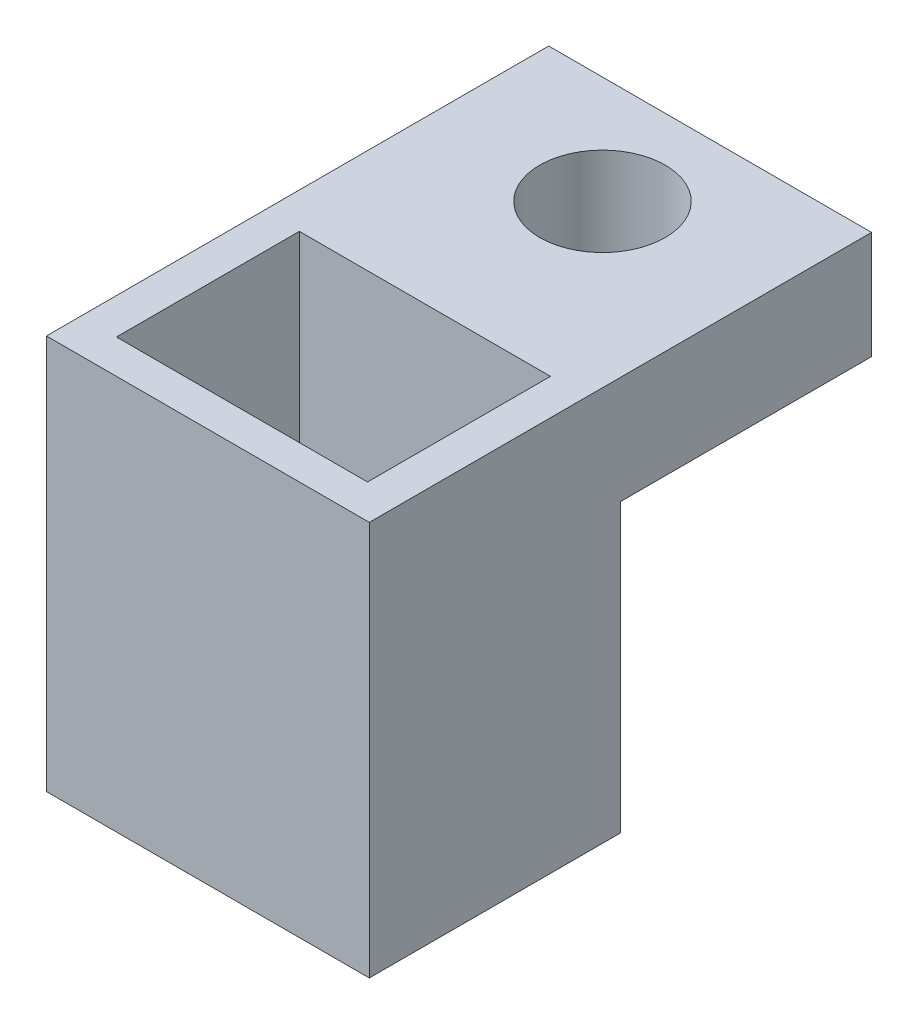
from build123d import *

# Parameters (mm, degrees)
BOSS_EXTRUDE2_DEPTH = 9
SKETCH6_R           = 1.75
SKETCH6_W           = 7
SKETCH6_H           = 5.1
CUT_EXTRUDE1_DEPTH  = 16.842979518


with BuildPart() as part:
    # Sketch4 → Boss-Extrude2 (new body)
    with BuildSketch(Plane(origin=(0, 0, 0), x_dir=(0, 0, -1), z_dir=(1, 0, 0))):
        Polygon((0, 0), (0, -8), (-7, -8), (-7, 3), (7, 3), (7, 0), align=None)
    extrude(amount=BOSS_EXTRUDE2_DEPTH)

    # Sketch6 → Cut-Extrude1 (cut, through all)
    with BuildSketch(Plane(origin=(0, 3, 0), x_dir=(1, 0, 0), z_dir=(0, 1, 0))):
        with Locations((4.5, 4)):
            Circle(SKETCH6_R)
        with Locations((4.5, -3.5)):
            Rectangle(SKETCH6_W, SKETCH6_H)
    extrude(amount=-CUT_EXTRUDE1_DEPTH, mode=Mode.SUBTRACT)


solid = part.part
